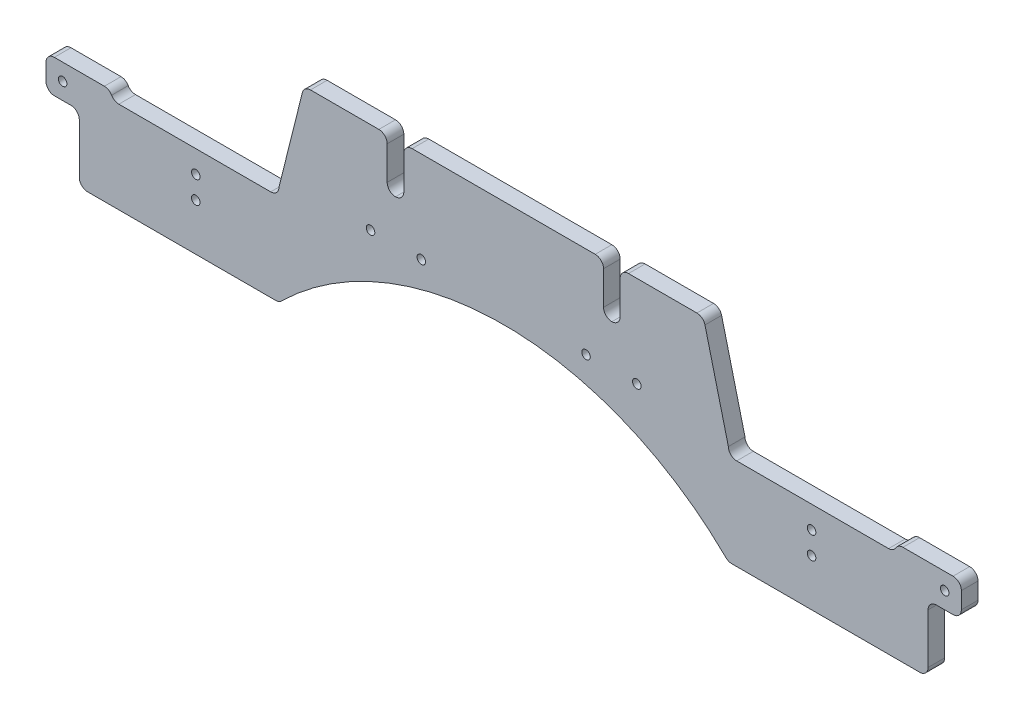
from build123d import *

# Parameters (mm, degrees)
SKETCH1_R           = 3.2639
BOSS_EXTRUDE1_DEPTH = 6.35
FILLET1_R           = 6.35
SKETCH2_R           = 3.2639
CUT_EXTRUDE2_DEPTH  = 375.272921719
SKETCH3_R           = 3.2639
CUT_EXTRUDE3_DEPTH  = 375.272921719
FILLET2_R           = 6.35


with BuildPart() as part:
    # Sketch1 → Boss-Extrude1 (new, symmetric)
    with BuildSketch(Plane.XY):
        with BuildLine():
            Line((-323.85, -18.447144741), (-171.45, -18.447144741))
            ThreePointArc((-171.45, -18.447144741), (0, 52.569770528), (171.45, -18.447144741))
            Line((171.45, -18.447144741), (323.85, -18.447144741))
            Line((323.85, -18.447144741), (323.85, 32.352855259))
            Line((323.85, 32.352855259), (349.25, 32.352855259))
            Line((349.25, 32.352855259), (349.25, 57.752855259))
            Line((349.25, 57.752855259), (300.0375, 57.752855259))
            Line((300.0375, 57.752855259), (300.0375, 51.402855259))
            Line((300.0375, 51.402855259), (171.45, 51.402855259))
            Line((171.45, 51.402855259), (171.45, 57.752855259))
            Line((171.45, 57.752855259), (152.4, 133.952855259))
            Line((152.4, 133.952855259), (88.9, 133.952855259))
            Line((88.9, 133.952855259), (88.9, 95.776655259))
            Line((88.9, 95.776655259), (76.2, 95.776655259))
            Line((76.2, 95.776655259), (76.2, 133.952855259))
            Line((76.2, 133.952855259), (-76.2, 133.952855259))
            Line((-76.2, 133.952855259), (-76.2, 95.776655259))
            Line((-76.2, 95.776655259), (-88.9, 95.776655259))
            Line((-88.9, 95.776655259), (-88.9, 133.952855259))
            Line((-88.9, 133.952855259), (-152.4, 133.952855259))
            Line((-152.4, 133.952855259), (-171.45, 57.752855259))
            Line((-171.45, 57.752855259), (-171.45, 51.402855259))
            Line((-171.45, 51.402855259), (-300.0375, 51.402855259))
            Line((-300.0375, 51.402855259), (-300.0375, 57.752855259))
            Line((-300.0375, 57.752855259), (-349.25, 57.752855259))
            Line((-349.25, 57.752855259), (-349.25, 32.352855259))
            Line((-349.25, 32.352855259), (-323.85, 32.352855259))
            Line((-323.85, 32.352855259), (-323.85, -18.447144741))
        make_face()
        with Locations((-336.55, 45.052855259)):
            Circle(SKETCH1_R, mode=Mode.SUBTRACT)
        with Locations(Location((336.55, 45.052855259, 0), (0, 0, 180))):
            Circle(SKETCH1_R, mode=Mode.SUBTRACT)
    extrude(amount=BOSS_EXTRUDE1_DEPTH, both=True)

    # Fillet1
    fillet1_edges = [part.edges().sort_by_distance(p)[0] for p in [
        (88.9, 95.776655259, 0),
        (76.2, 95.776655259, 0),
        (-88.9, 95.776655259, 0),
        (-76.2, 95.776655259, 0),
        (323.85, 32.352855259, 0),
        (171.45, 51.402855259, 0),
        (300.0375, 51.402855259, 0),
        (-171.45, 51.402855259, 0),
        (-300.0375, 51.402855259, 0),
        (-323.85, 32.352855259, 0),
    ]]
    fillet(fillet1_edges, radius=FILLET1_R - 0.0001)  # a hair under: the kernel refuses the full size

    # Sketch2 → Cut-Extrude2 (cut, through all)
    with BuildSketch(Plane.XY.offset(6.35)):
        with Locations((-234.95, 17.366855259)):
            Circle(SKETCH2_R)
        with Locations((-234.95, 34.384855259)):
            Circle(SKETCH2_R)
        with Locations((234.95, 34.384855259)):
            Circle(SKETCH2_R)
        with Locations((234.95, 17.366855259)):
            Circle(SKETCH2_R)
    extrude(amount=-CUT_EXTRUDE2_DEPTH, mode=Mode.SUBTRACT)

    # Sketch3 → Cut-Extrude3 (cut, through all)
    with BuildSketch(Plane.XY.offset(6.35)):
        with Locations((-101.6, 64.198647102)):
            Circle(SKETCH3_R)
        with Locations((101.6, 64.198647102)):
            Circle(SKETCH3_R)
        with Locations((-62.834515607, 64.198647102)):
            Circle(SKETCH3_R)
        with Locations(Location((62.834515607, 64.198647102, 0), (0, 0, 180))):
            Circle(SKETCH3_R)
    extrude(amount=-CUT_EXTRUDE3_DEPTH, mode=Mode.SUBTRACT)

    # Fillet2
    fillet2_edges = [part.edges().sort_by_distance(p)[0] for p in [
        (-152.4, 133.952855259, 0),
        (-88.9, 133.952855259, 0),
        (-76.2, 133.952855259, 0),
        (76.2, 133.952855259, 0),
        (88.9, 133.952855259, 0),
        (152.4, 133.952855259, 0),
        (300.0375, 57.752855259, 0),
        (349.25, 57.752855259, 0),
        (349.25, 32.352855259, 0),
        (323.85, -18.447144741, 0),
        (171.45, -18.447144741, 0),
        (-171.45, -18.447144741, 0),
        (-323.85, -18.447144741, 0),
        (-349.25, 32.352855259, 0),
        (-349.25, 57.752855259, 0),
        (-300.0375, 57.752855259, 0),
    ]]
    fillet(fillet2_edges, radius=FILLET2_R)


solid = part.part
